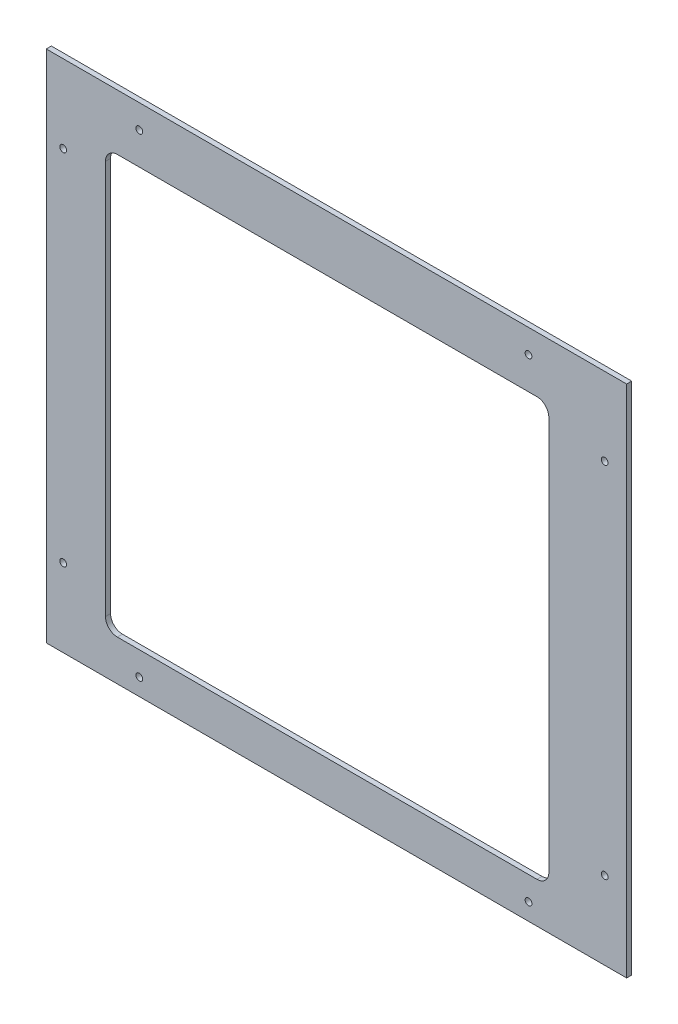
from build123d import *

# Parameters (mm, degrees)
SKETCH1_W           = 343
SKETCH1_H           = 304
SKETCH1_R           = 2
BOSS_EXTRUDE1_DEPTH = 3


with BuildPart() as part:
    # Sketch1 → Boss-Extrude1 (new body)
    with BuildSketch(Plane.XY):
        with Locations((1.5, 0)):
            Rectangle(SKETCH1_W, SKETCH1_H)
        with Locations((-160, -106)):
            Circle(SKETCH1_R, mode=Mode.SUBTRACT)
        with Locations((-115, -142)):
            Circle(SKETCH1_R, mode=Mode.SUBTRACT)
        with Locations((115, -142)):
            Circle(SKETCH1_R, mode=Mode.SUBTRACT)
        with Locations((160, -106)):
            Circle(SKETCH1_R, mode=Mode.SUBTRACT)
        with BuildLine():
            ThreePointArc((127, -121), (124.949747468, -125.949747468), (120, -128))
            Line((120, -128), (-128, -128))
            ThreePointArc((-128, -128), (-132.949747468, -125.949747468), (-135, -121))
            Line((-135, -121), (-135, 112))
            ThreePointArc((-135, 112), (-132.949747468, 116.949747468), (-128, 119))
            Line((-128, 119), (120, 119))
            ThreePointArc((120, 119), (124.949747468, 116.949747468), (127, 112))
            Line((127, 112), (127, -121))
        make_face(mode=Mode.SUBTRACT)
        with Locations((-160, 106)):
            Circle(SKETCH1_R, mode=Mode.SUBTRACT)
        with Locations((-115, 138)):
            Circle(SKETCH1_R, mode=Mode.SUBTRACT)
        with Locations((160, 106)):
            Circle(SKETCH1_R, mode=Mode.SUBTRACT)
        with Locations((115, 138)):
            Circle(SKETCH1_R, mode=Mode.SUBTRACT)
    extrude(amount=BOSS_EXTRUDE1_DEPTH)


solid = part.part
